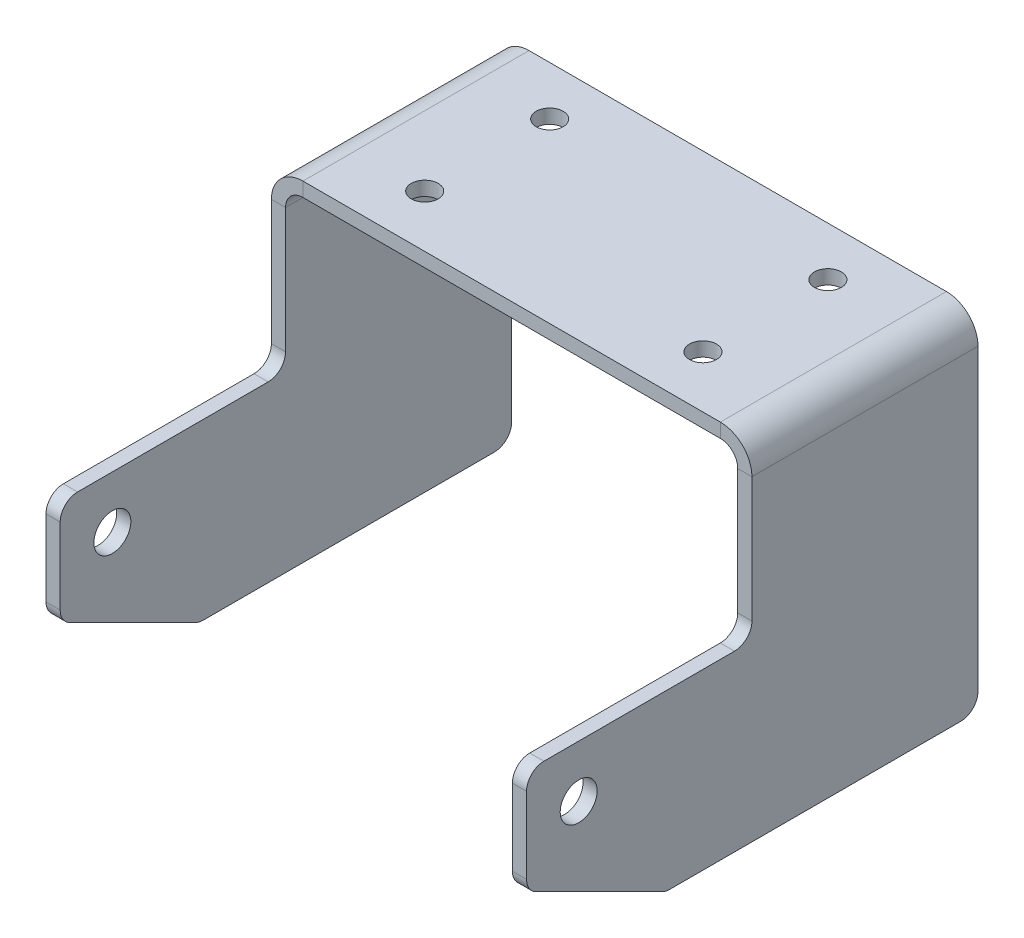
from build123d import *

# Parameters (mm, degrees)
SKETCH1_W                    = 41.275
SKETCH1_H                    = 2.58826
BASE_FLANGE1_DEPTH           = 82.55
EDGE_FLANGE1_STRIP_W         = 16.70304
EDGE_FLANGE1_STRIP_H         = 2.58826
EDGE_FLANGE1_STRIP_CUT_DEPTH = 41.275
EDGE_FLANGE1_DEPTH           = 41.275
EDGE_FLANGE1_START           = 2.58826
EDGE_FLANGE1_FLAT_DEPTH      = 2.58826
EDGE_FLANGE2_STRIP_W         = 16.70304
EDGE_FLANGE2_STRIP_H         = 2.58826
EDGE_FLANGE2_STRIP_CUT_DEPTH = 41.275
EDGE_FLANGE2_DEPTH           = 41.275
EDGE_FLANGE2_START           = 2.58826
EDGE_FLANGE2_FLAT_DEPTH      = 2.58826
F_1_4_CLEARANCE_HOLE1_D      = 6.7564
F_10_0_1935_DIAMETER_HOLE1_D = 4.9149
SKETCH19_W                   = 9.191105822
SKETCH19_H                   = 31.75
CUT_EXTRUDE1_DEPTH           = 416.675275559
FILLET2_START                = -2.58826
FILLET2_DEPTH                = 87.72652
FILLET2_2_DEPTH              = 2.58826
FILLET2_START_2              = 82.55
FILLET2_3_DEPTH              = 2.58826


with BuildPart() as part:
    # Base-Flange1: sheet metal written as solids
    # Sketch1 → Base-Flange1 (new body)
    with BuildSketch(Plane(origin=(0, 0, 0), x_dir=(0, 0, -1), z_dir=(1, 0, 0))):
        with Locations((-330.343394178, 62.20587)):
            Rectangle(SKETCH1_W, SKETCH1_H)
    extrude(amount=BASE_FLANGE1_DEPTH)

    # Edge-Flange1: sheet metal written as solids
    # Edge-Flange1 strip (on a plane across the edge) → Edge-Flange1 strip cut (cut)
    with BuildSketch(Plane(origin=(82.55, 60.91174, 309.705894178), x_dir=(-1, 0, 0), z_dir=(0, 0, 1))):
        with Locations((-5.17652, -1.29413)):
            Rectangle(EDGE_FLANGE1_STRIP_W, EDGE_FLANGE1_STRIP_H)
    extrude(amount=EDGE_FLANGE1_STRIP_CUT_DEPTH, mode=Mode.SUBTRACT)

    # Edge-Flange1 bend section (on a plane across the edge) → Edge-Flange1 (add)
    with BuildSketch(Plane(origin=(82.55, 60.91174, 309.705894178), x_dir=(-1, 0, 0), z_dir=(0, 0, 1))):
        with BuildLine():
            Line((-2.58826, 3.175), (0, 3.175))
            ThreePointArc((0, 3.175), (0.92993597, 0.92993597), (3.175, 0))
            Line((3.175, 0), (3.175, -2.58826))
            ThreePointArc((3.175, -2.58826), (-0.900240228, -0.900240228), (-2.58826, 3.175))
        make_face()
    extrude(amount=EDGE_FLANGE1_DEPTH)

    # Edge-Flange1 profile (on flange) → Edge-Flange1 flat (add)
    with BuildSketch(Plane(origin=(82.55, 60.91174, 0), x_dir=(0, 0, 1), z_dir=(1, 0, 0)).offset(EDGE_FLANGE1_START)):
        Polygon((350.980894178, 3.175), (350.980894178, 12.7), (350.980894178, 29.16174), (401.32, 29.16174), (401.32, 60.91174), (309.705894178, 60.91174), (309.705894178, 12.7), (309.705894178, 3.175), align=None)
    extrude(amount=-EDGE_FLANGE1_FLAT_DEPTH)

    # Edge-Flange2: sheet metal written as solids
    # Edge-Flange2 strip (on a plane across the edge) → Edge-Flange2 strip cut (cut)
    with BuildSketch(Plane(origin=(0, 60.91174, 350.980894178), x_dir=(1, 0, 0), z_dir=(0, 0, -1))):
        with Locations((-5.17652, -1.29413)):
            Rectangle(EDGE_FLANGE2_STRIP_W, EDGE_FLANGE2_STRIP_H)
    extrude(amount=EDGE_FLANGE2_STRIP_CUT_DEPTH, mode=Mode.SUBTRACT)

    # Edge-Flange2 bend section (on a plane across the edge) → Edge-Flange2 (add)
    with BuildSketch(Plane(origin=(0, 60.91174, 350.980894178), x_dir=(1, 0, 0), z_dir=(0, 0, -1))):
        with BuildLine():
            Line((-2.58826, 3.175), (0, 3.175))
            ThreePointArc((0, 3.175), (0.92993597, 0.92993597), (3.175, 0))
            Line((3.175, 0), (3.175, -2.58826))
            ThreePointArc((3.175, -2.58826), (-0.900240228, -0.900240228), (-2.58826, 3.175))
        make_face()
    extrude(amount=EDGE_FLANGE2_DEPTH)

    # Edge-Flange2 profile (on flange) → Edge-Flange2 flat (add)
    with BuildSketch(Plane(origin=(0, 60.91174, 0), x_dir=(0, 0, -1), z_dir=(-1, 0, 0)).offset(EDGE_FLANGE2_START)):
        Polygon((-350.980894178, 12.7), (-350.980894178, 3.175), (-309.705894178, 3.175), (-309.705894178, 12.7), (-309.705894178, 60.91174), (-401.32, 60.91174), (-401.32, 29.16174), (-350.980894178, 29.16174), align=None)
    extrude(amount=-EDGE_FLANGE2_FLAT_DEPTH)

    # 1/4 Clearance Hole1 (through all)
    with Locations(Plane.ZY.offset(2.58826)):
        with Locations((382.603894178, 22.225)):
            Hole(F_1_4_CLEARANCE_HOLE1_D / 2)

    # #10 (0.1935) Diameter Hole1 (through all)
    with Locations(Plane(origin=(0, 63.5, 0), x_dir=(1, 0, 0), z_dir=(0, 1, 0))):
        with Locations((15.875, -318.644154178), (15.875, -341.455894178), (66.675, -341.455894178), (66.675, -318.644154178)):
            Hole(F_10_0_1935_DIAMETER_HOLE1_D / 2)

    # Sketch19 → Cut-Extrude1 (cut, through all)
    with BuildSketch(Plane.ZY.offset(2.58826)):
        with Locations((396.724447089, 15.875)):
            Rectangle(SKETCH19_W, SKETCH19_H)
    extrude(amount=-CUT_EXTRUDE1_DEPTH, mode=Mode.SUBTRACT)

    # Fillet2: read off the stored shape, not the designer's step
    # Fillet2 outline → Fillet2 (cut)
    with BuildSketch(Plane.YZ.offset(FILLET2_START)):
        with BuildLine():
            ThreePointArc((0, 365.97937835), (0.084934458, 366.708843873), (0.335193669, 367.399281516))
            Line((0.335193669, 367.399281516), (11.822451583, 390.373797344))
            ThreePointArc((11.822451583, 390.373797344), (12.993061633, 391.654710495), (14.662257914, 392.128894178))
            Line((14.662257914, 392.128894178), (0, 392.128894178))
            Line((0, 392.128894178), (0, 365.97937835))
        make_face()
        with BuildLine():
            ThreePointArc((3.175, 309.705894178), (0.92993597, 310.635830148), (0, 312.880894178))
            Line((0, 312.880894178), (0, 309.705894178))
            Line((0, 309.705894178), (3.175, 309.705894178))
        make_face()
        with BuildLine():
            Line((31.75, 392.128894178), (28.575, 392.128894178))
            ThreePointArc((28.575, 392.128894178), (30.820064031, 391.198958209), (31.75, 388.953894178))
            Line((31.75, 388.953894178), (31.75, 392.128894178))
        make_face()
    extrude(amount=FILLET2_DEPTH, mode=Mode.SUBTRACT)

    # Fillet2 2 outline → Fillet2 2 (add)
    with BuildSketch(Plane.YZ.offset(FILLET2_START)):
        with BuildLine():
            ThreePointArc((34.925, 350.980894178), (32.67993597, 351.910830148), (31.75, 354.155894178))
            Line((31.75, 354.155894178), (31.75, 350.980894178))
            Line((31.75, 350.980894178), (34.925, 350.980894178))
        make_face()
    extrude(amount=FILLET2_2_DEPTH)

    # Fillet2 3 outline → Fillet2 3 (add)
    with BuildSketch(Plane.YZ.offset(FILLET2_START_2)):
        with BuildLine():
            ThreePointArc((34.925, 350.980894178), (32.67993597, 351.910830148), (31.75, 354.155894178))
            Line((31.75, 354.155894178), (31.75, 350.980894178))
            Line((31.75, 350.980894178), (34.925, 350.980894178))
        make_face()
    extrude(amount=FILLET2_3_DEPTH)


solid = part.part
